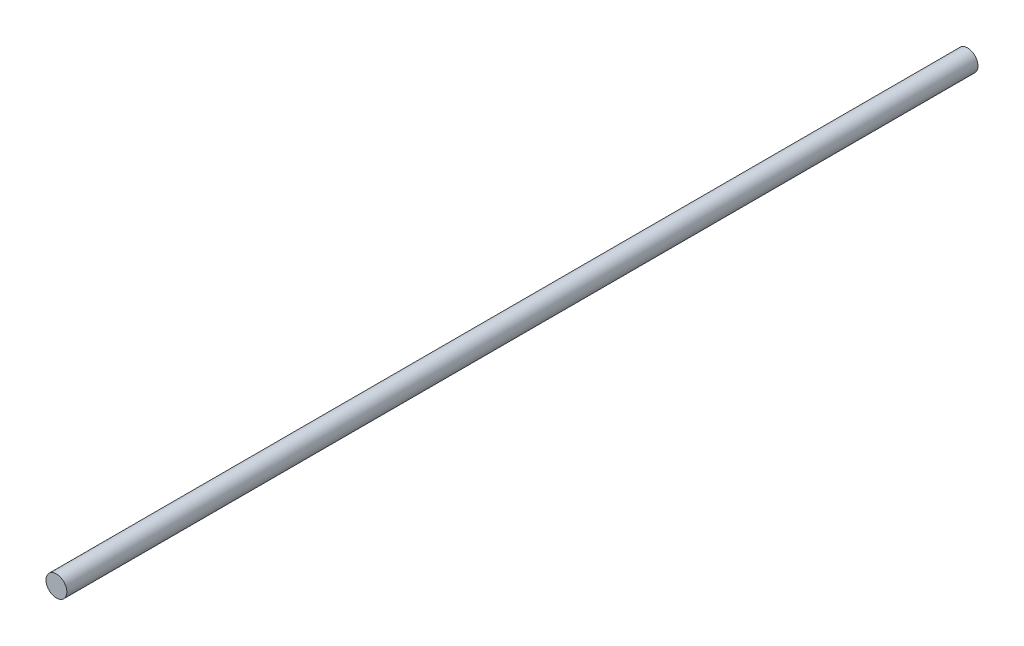
from build123d import *

# Parameters (mm, degrees)
SKETCH1_R           = 6
BOSS_EXTRUDE1_DEPTH = 262


with BuildPart() as part:
    # Sketch1 → Boss-Extrude1 (new, symmetric)
    with BuildSketch(Plane.XY):
        Circle(SKETCH1_R)
    extrude(amount=BOSS_EXTRUDE1_DEPTH, both=True)


solid = part.part
